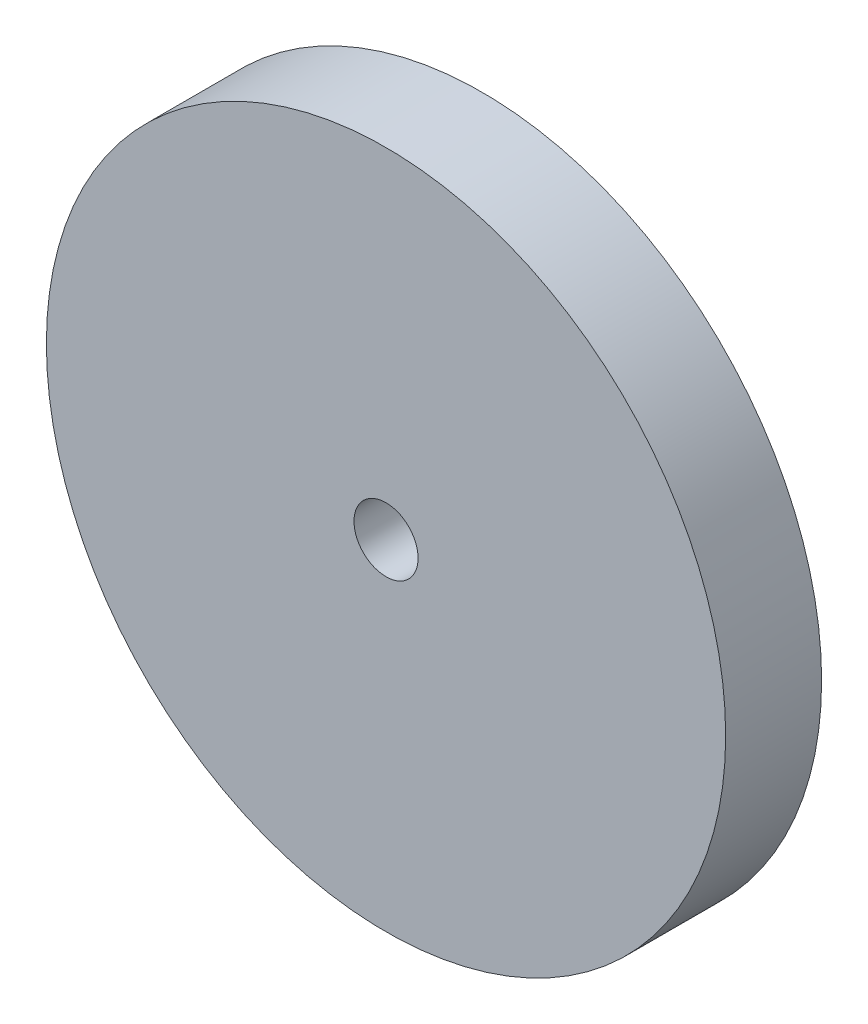
from build123d import *

# Parameters (mm, degrees)
SKETCH1_R           = 19.78095238
SKETCH1_R_2         = 1.8669
BOSS_EXTRUDE1_DEPTH = 5.588


with BuildPart() as part:
    # Sketch1 → Boss-Extrude1 (new body)
    with BuildSketch(Plane.XY):
        Circle(SKETCH1_R)
        Circle(SKETCH1_R_2, mode=Mode.SUBTRACT)
    extrude(amount=BOSS_EXTRUDE1_DEPTH)


solid = part.part
